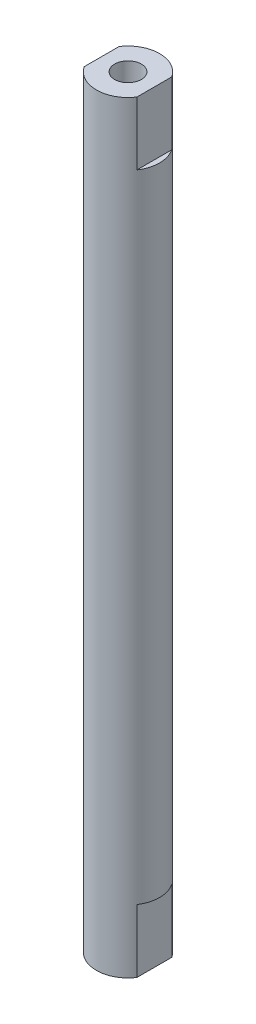
from build123d import *

# Parameters (mm, degrees)
SKETCH1_W          = 1.5875
SKETCH1_H          = 76.9
CUT_EXTRUDE3_START = -9.525
CUT_EXTRUDE3_DEPTH = 9.525
CUT_EXTRUDE4_DEPTH = 9.525


# Read off the part's stored shape, not the designer's step: Tap Drill for #10-32 Tap1
with BuildPart() as part:
    # Sketch1 → Revolve1 (revolve)
    with BuildSketch(Plane.XY, mode=Mode.PRIVATE) as revolve1_sk:
        with Locations((-3.96875, 0)):
            Rectangle(SKETCH1_W, SKETCH1_H)
        Polygon((0, -57.5), (-4.7625, -57.5), (-4.7625, -38.45), (-3.175, -38.45), (-3.175, 38.45), (-4.7625, 38.45), (-4.7625, 57.5), (0, 57.5), align=None)
    revolve(revolve1_sk.sketch.rotate(Axis((0, -57.5, 0), (0, 1, 0)), 180), axis=Axis((0, -57.5, 0), (0, 1, 0)))

    # Sketch2 → Cut-Extrude3 (cut)
    with BuildSketch(Plane.XZ.offset(57.5).offset(CUT_EXTRUDE3_START)):
        with BuildLine():
            Line((-3.96875, -2.632570927), (-3.96875, 2.632570927))
            ThreePointArc((-3.96875, 2.632570927), (-4.7625, 0), (-3.96875, -2.632570927))
        make_face()
        with BuildLine():
            Line((3.96875, -2.632570927), (3.96875, 2.632570927))
            ThreePointArc((3.96875, 2.632570927), (4.7625, 0), (3.96875, -2.632570927))
        make_face()
    extrude(amount=CUT_EXTRUDE3_DEPTH, mode=Mode.SUBTRACT)

    # Sketch5 → Cut-Extrude4 (cut)
    with BuildSketch(Plane(origin=(0, 57.5, 0), x_dir=(1, 0, 0), z_dir=(0, 1, 0))):
        with BuildLine():
            Line((-3.96875, -2.632570927), (-3.96875, 2.632570927))
            ThreePointArc((-3.96875, 2.632570927), (-4.7625, 0), (-3.96875, -2.632570927))
        make_face()
        with BuildLine():
            Line((3.96875, -2.632570927), (3.96875, 2.632570927))
            ThreePointArc((3.96875, 2.632570927), (4.7625, 0), (3.96875, -2.632570927))
        make_face()
    extrude(amount=-CUT_EXTRUDE4_DEPTH, mode=Mode.SUBTRACT)

    # Tap Drill for #10-32 Tap1 outline → Tap Drill for #10-32 Tap1 (revolve, cut)
    with BuildSketch(Plane.XY):
        Polygon((0, 57.5), (0, 40.284682152), (2.0193, 41.498), (2.0193, 57.5), align=None)
        Polygon((2.0193, -41.498), (0, -40.284682152), (0, -57.5), (2.0193, -57.5), align=None)
    revolve(axis=Axis((0, 0, 0), (0, 1, 0)), mode=Mode.SUBTRACT)


solid = part.part
